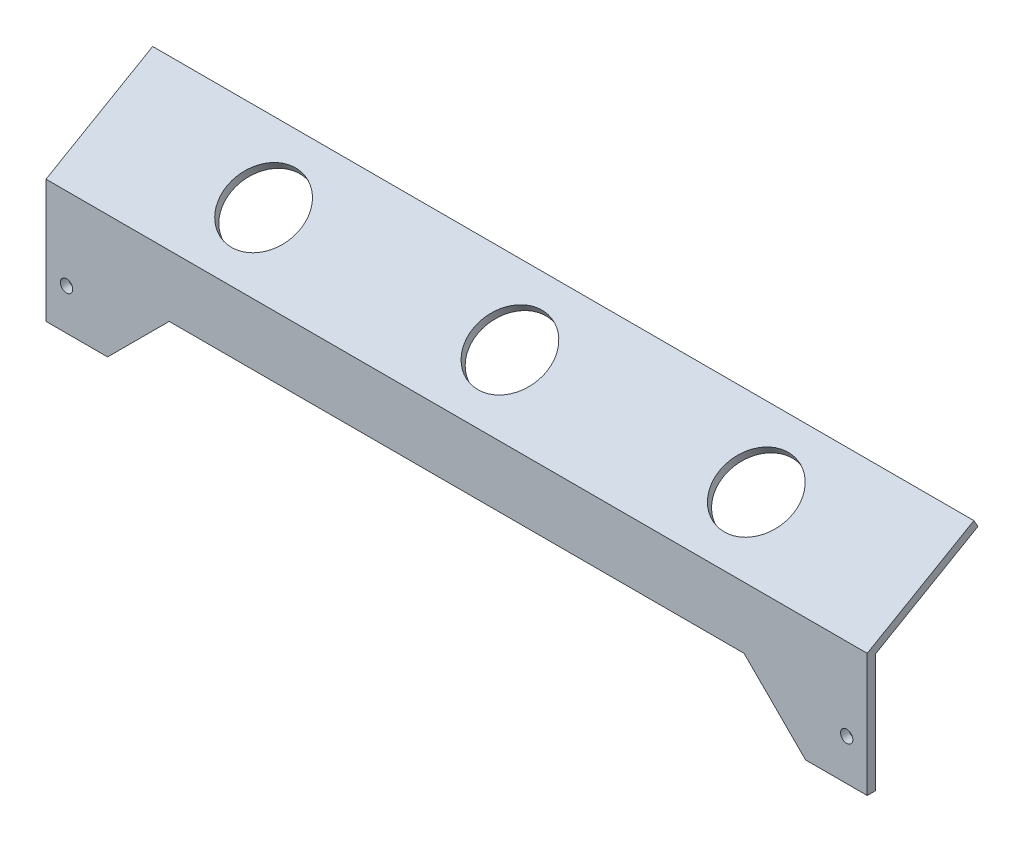
from build123d import *

# Parameters (mm, degrees)
BOSS_EXTRUDE1_DEPTH = 100
SKETCH2_R           = 1.5
CUT_EXTRUDE1_DEPTH  = 10
SKETCH4_R           = 9
CUT_EXTRUDE2_DEPTH  = 10


with BuildPart() as part:
    # Sketch1 → Boss-Extrude1 (new, symmetric)
    with BuildSketch(Plane(origin=(0, 0, 0), x_dir=(0, 0, -1), z_dir=(1, 0, 0))):
        Polygon((0, 0), (2, 0), (2, 28.845299462), (26.980762114, 43.267949192), (25.980762114, 45), (0, 30), align=None)
    extrude(amount=BOSS_EXTRUDE1_DEPTH, both=True)

    # Sketch2 → Cut-Extrude1 (cut)
    with BuildSketch(Plane.XY):
        with Locations((-95, 10)):
            Circle(SKETCH2_R)
        with Locations((95, 10)):
            Circle(SKETCH2_R)
        Polygon((-85, 0), (-70, 15), (70, 15), (85, 0), align=None)
    extrude(amount=-CUT_EXTRUDE1_DEPTH, mode=Mode.SUBTRACT)

    # Sketch4 → Cut-Extrude2 (cut)
    with BuildSketch(Plane(origin=(0, 22.5, 12.990381057), x_dir=(1, 0, 0), z_dir=(0, 0.8660254037844396, 0.4999999999999985))):
        with Locations((0, 30)):
            Circle(SKETCH4_R)
        with Locations((60, 30)):
            Circle(SKETCH4_R)
        with Locations((-60, 30)):
            Circle(SKETCH4_R)
    extrude(amount=-CUT_EXTRUDE2_DEPTH, mode=Mode.SUBTRACT)


solid = part.part
